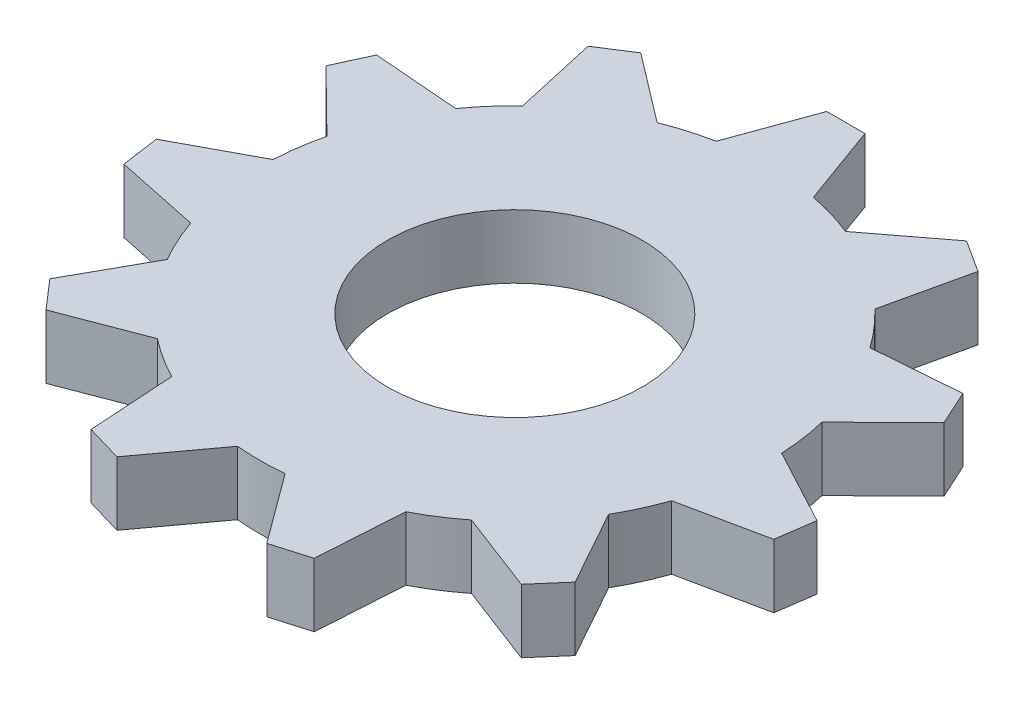
from build123d import *

# Parameters (mm, degrees)
SKETCH1_R           = 20
BOSS_EXTRUDE1_DEPTH = 5
BOSS_EXTRUDE2_START = -5
BOSS_EXTRUDE2_DEPTH = 5
SKETCH3_R           = 10
CUT_EXTRUDE1_DEPTH  = 5


with BuildPart() as part:
    # Sketch1 → Boss-Extrude1 (new body)
    with BuildSketch(Plane(origin=(0, 0, 0), x_dir=(1, 0, 0), z_dir=(0, 1, 0))):
        Circle(SKETCH1_R)
    extrude(amount=BOSS_EXTRUDE1_DEPTH)

    # Sketch2 → Boss-Extrude2 (add)
    with BuildSketch(Plane(origin=(0, 5, 0), x_dir=(1, 0, 0), z_dir=(0, 1, 0)).offset(BOSS_EXTRUDE2_START)):
        with BuildLine():
            Line((-1.5, 26), (-3.817670017, 19.632253962))
            ThreePointArc((-3.817670017, 19.632253962), (0, 20), (3.817670017, 19.632253962))
            Line((3.817670017, 19.632253962), (1.5, 26))
            Line((1.5, 26), (-1.5, 26))
        make_face()
        with BuildLine():
            ThreePointArc((-13.82562622, 14.451714764), (-10.812816349, 16.825070657), (-7.402369442, 18.579691242))
            Line((-7.402369442, 18.579691242), (-12.794780955, 22.68355308))
            Line((-12.794780955, 22.68355308), (-15.318541553, 21.061630627))
            Line((-15.318541553, 21.061630627), (-13.82562622, 14.451714764))
        make_face()
        with BuildLine():
            Line((12.794780955, 22.68355308), (7.402369442, 18.579691242))
            ThreePointArc((7.402369442, 18.579691242), (10.812816349, 16.825070657), (13.82562622, 14.451714764))
            Line((13.82562622, 14.451714764), (15.318541553, 21.061630627))
            Line((15.318541553, 21.061630627), (12.794780955, 22.68355308))
        make_face()
        with BuildLine():
            ThreePointArc((-19.444043785, 4.68285824), (-18.192639907, 8.30830026), (-16.272208905, 11.62820783))
            Line((-16.272208905, 11.62820783), (-23.02730936, 12.165238331))
            Line((-23.02730936, 12.165238331), (-24.273554399, 9.436342345))
            Line((-24.273554399, 9.436342345), (-19.444043785, 4.68285824))
        make_face()
        with BuildLine():
            Line((23.02730936, 12.165238331), (16.272208905, 11.62820783))
            ThreePointArc((16.272208905, 11.62820783), (18.192639907, 8.30830026), (19.444043785, 4.68285824))
            Line((19.444043785, 4.68285824), (24.273554399, 9.436342345))
            Line((24.273554399, 9.436342345), (23.02730936, 12.165238331))
        make_face()
        with BuildLine():
            ThreePointArc((-18.889114833, -6.572772689), (-19.796428838, -2.846296765), (-19.975737015, 0.984850593))
            Line((-19.975737015, 0.984850593), (-25.948829746, -2.215453632))
            Line((-25.948829746, -2.215453632), (-25.521885231, -5.184917958))
            Line((-25.521885231, -5.184917958), (-18.889114833, -6.572772689))
        make_face()
        with BuildLine():
            Line((25.948829746, -2.215453632), (19.975737015, 0.984850593))
            ThreePointArc((19.975737015, 0.984850593), (19.796428838, -2.846296765), (18.889114833, -6.572772689))
            Line((18.889114833, -6.572772689), (25.521885231, -5.184917958))
            Line((25.521885231, -5.184917958), (25.948829746, -2.215453632))
        make_face()
        with BuildLine():
            ThreePointArc((-12.337025386, -15.741594729), (-15.114991487, -13.097214679), (-17.337109765, -9.971189748))
            Line((-17.337109765, -9.971189748), (-20.631780034, -15.892754721))
            Line((-20.631780034, -15.892754721), (-18.667197832, -18.160003444))
            Line((-18.667197832, -18.160003444), (-12.337025386, -15.741594729))
        make_face()
        with BuildLine():
            Line((20.631780034, -15.892754721), (17.337109765, -9.971189748))
            ThreePointArc((17.337109765, -9.971189748), (15.114991487, -13.097214679), (12.337025386, -15.741594729))
            Line((12.337025386, -15.741594729), (18.667197832, -18.160003444))
            Line((18.667197832, -18.160003444), (20.631780034, -15.892754721))
        make_face()
        with BuildLine():
            ThreePointArc((-1.868017548, -19.912571668), (-5.634651137, -19.189859472), (-9.194072662, -17.761447798))
            Line((-9.194072662, -17.761447798), (-8.764285938, -24.524218479))
            Line((-8.764285938, -24.524218479), (-5.885807017, -25.369416149))
            Line((-5.885807017, -25.369416149), (-1.868017548, -19.912571668))
        make_face()
        with BuildLine():
            Line((8.764285938, -24.524218479), (9.194072662, -17.761447798))
            ThreePointArc((9.194072662, -17.761447798), (5.634651137, -19.189859472), (1.868017548, -19.912571668))
            Line((1.868017548, -19.912571668), (5.885807017, -25.369416149))
            Line((5.885807017, -25.369416149), (8.764285938, -24.524218479))
        make_face()
    extrude(amount=BOSS_EXTRUDE2_DEPTH)

    # Sketch3 → Cut-Extrude1 (cut)
    with BuildSketch(Plane(origin=(0, 5, 0), x_dir=(1, 0, 0), z_dir=(0, 1, 0))):
        Circle(SKETCH3_R)
    extrude(amount=-CUT_EXTRUDE1_DEPTH, mode=Mode.SUBTRACT)


solid = part.part
